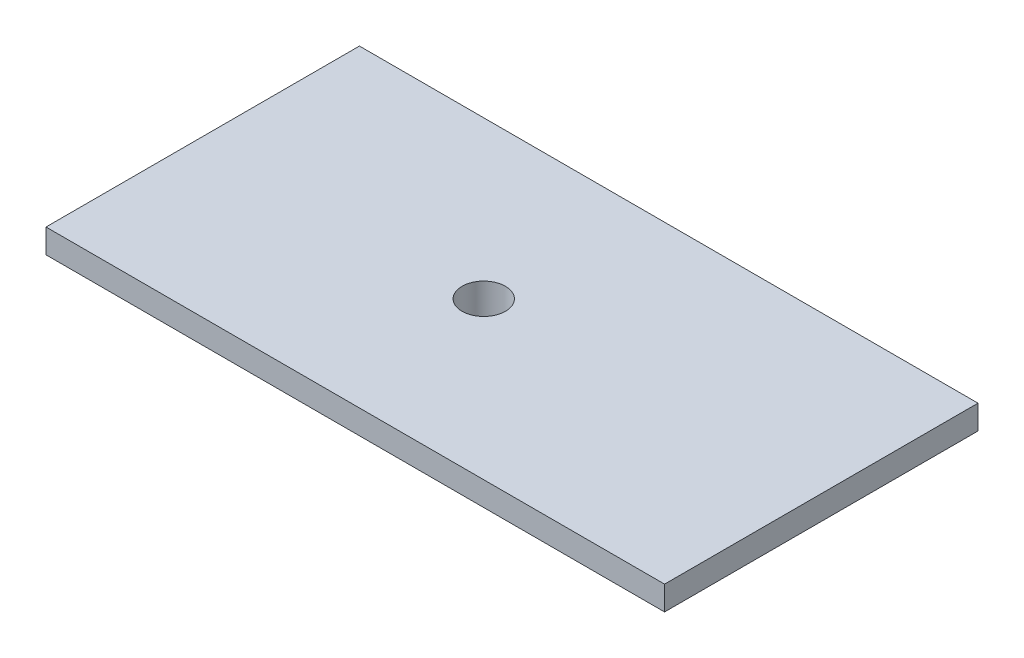
from build123d import *

# Parameters (mm, degrees)
SKETCH1_W           = 128.28
SKETCH1_H           = 65
BOSS_EXTRUDE1_DEPTH = 5
SKETCH3_W           = 118.08
SKETCH3_H           = 54.8
BOSS_EXTRUDE2_DEPTH = 5
CUT_EXTRUDE1_REACH  = 146.155
SKETCH4_R           = 4.5


with BuildPart() as part:
    # Sketch1 → Boss-Extrude1 (new body)
    with BuildSketch(Plane(origin=(0, 0, 0), x_dir=(1, 0, 0), z_dir=(0, 1, 0))):
        with Locations((-64.14, 32.5)):
            Rectangle(SKETCH1_W, SKETCH1_H)
    extrude(amount=BOSS_EXTRUDE1_DEPTH)

    # Sketch3 → Boss-Extrude2 (add)
    with BuildSketch(Plane.XZ):
        with Locations((-64.14, -32.5)):
            Rectangle(SKETCH3_W, SKETCH3_H)
    extrude(amount=BOSS_EXTRUDE2_DEPTH)

    # Sketch4 → Cut-Extrude1 (cut, up to next)
    with BuildSketch(Plane(origin=(0, 5, 0), x_dir=(1, 0, 0), z_dir=(0, 1, 0)), mode=Mode.PRIVATE) as cut_extrude1_sk1:
        with Locations((-70, 32.5)):
            Circle(SKETCH4_R)
    cut_extrude1_tool1 = extrude(cut_extrude1_sk1.sketch, amount=-CUT_EXTRUDE1_REACH, mode=Mode.PRIVATE) & part.part
    add(cut_extrude1_tool1.solids().sort_by_distance((-70, 5, -32.5))[0], mode=Mode.SUBTRACT)


solid = part.part
